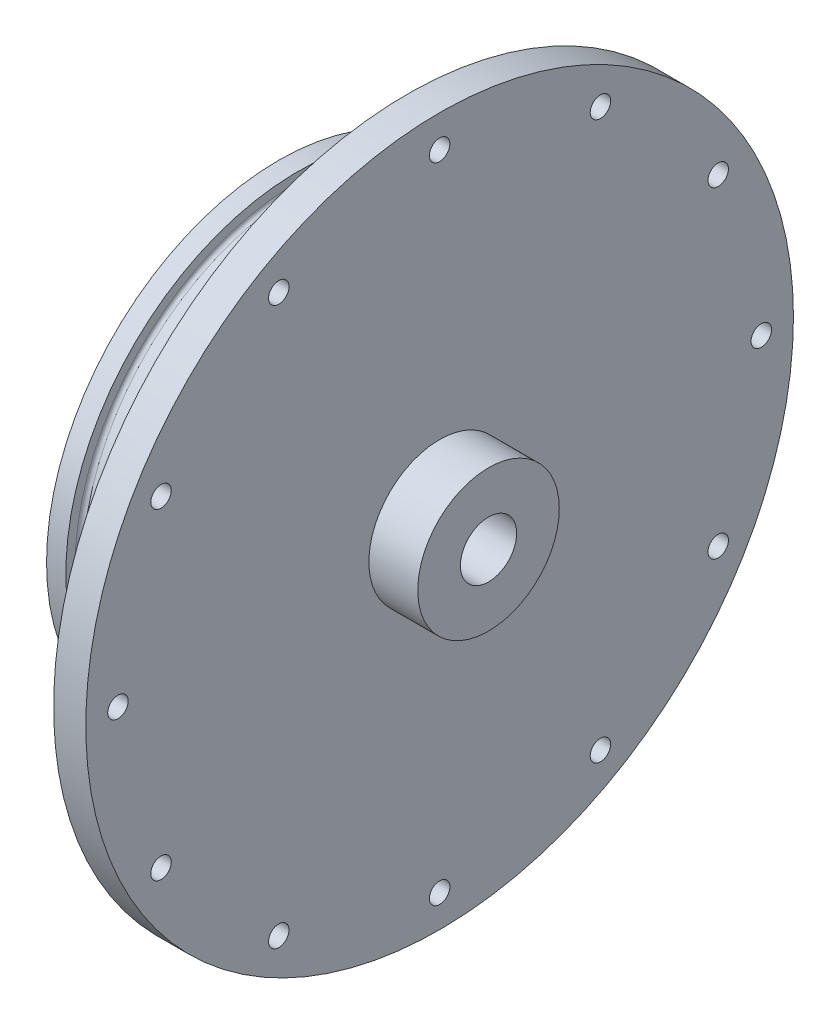
from build123d import *

# Parameters (mm, degrees)
SKETCH1_R               = 69.85
BOSS_EXTRUDE1_DEPTH     = 6.35
SKETCH2_R               = 45.847
BOSS_EXTRUDE2_DEPTH     = 25.4
SKETCH11_R              = 1.89865
CUT_EXTRUDE3_DEPTH      = 10.16
CIRPATTERN1_COUNT       = 12
CUT_EXTRUDE4_DEPTH      = 104.759854984
CUT_EXTRUDE4_DEPTH_BACK = 104.759854984
SKETCH15_R              = 5.55625
BOSS_EXTRUDE3_START     = 9.652
SKETCH17_R              = 13.97
SKETCH17_R_2            = 5.55625
BOSS_EXTRUDE3_DEPTH     = 9.652
SKETCH18_R              = 38.2905
CUT_EXTRUDE5_DEPTH      = 6.604
SKETCH19_R              = 1.1303
CUT_EXTRUDE6_DEPTH      = 6.35
SKETCH20_R              = 23.495
CUT_EXTRUDE7_DEPTH      = 19.05
FILLET1_R               = 2.54
CHAMFER1_SIZE           = 5.08
SKETCH21_R              = 2.0193
CUT_EXTRUDE8_DEPTH      = 104.759854954


with BuildPart() as part:
    # Sketch1 → Boss-Extrude1 (new body)
    with BuildSketch(Plane(origin=(0, 0, 0), x_dir=(0, 0, -1), z_dir=(1, 0, 0))):
        Circle(SKETCH1_R)
    extrude(amount=BOSS_EXTRUDE1_DEPTH)

    # Sketch2 → Boss-Extrude2 (add)
    with BuildSketch(Plane.ZY):
        Circle(SKETCH2_R)
    extrude(amount=BOSS_EXTRUDE2_DEPTH)

    # Sketch11 → Cut-Extrude3 (cut)
    with BuildSketch(Plane(origin=(0, 0, -45.847), x_dir=(-1, 0, 0), z_dir=(0, 0, -1))):
        with Locations((7.62, 0)):
            Circle(SKETCH11_R)
    cut_extrude3 = extrude(amount=-CUT_EXTRUDE3_DEPTH, mode=Mode.SUBTRACT)

    # CirPattern1: Cut-Extrude3 ×12 about axis
    cirpattern1_axis = Axis((0, 0, 0), (-1, 0, 0))
    for i in range(1, CIRPATTERN1_COUNT):
        add(cut_extrude3.rotate(cirpattern1_axis, i * 360 / CIRPATTERN1_COUNT), mode=Mode.SUBTRACT)

    # Sketch15 → Cut-Extrude4 (cut, two sides: drawn at the far end of the back side and taken through both)
    with BuildSketch(Plane(origin=(6.35, 0, 0), x_dir=(0, 0, -1), z_dir=(1, 0, 0)).offset(-CUT_EXTRUDE4_DEPTH_BACK)):
        Circle(SKETCH15_R)
    extrude(amount=CUT_EXTRUDE4_DEPTH + CUT_EXTRUDE4_DEPTH_BACK, mode=Mode.SUBTRACT)

    # Sketch16 → Cut-Revolve1 (revolve, cut)
    with BuildSketch(Plane.XY):
        with BuildLine():
            Line((-21.59, 45.847), (-14.4018, 45.847))
            Line((-14.4018, 45.847), (-14.4018, 44.069))
            ThreePointArc((-14.4018, 44.069), (-14.624984633, 43.530184633), (-15.1638, 43.307))
            Line((-15.1638, 43.307), (-20.828, 43.307))
            ThreePointArc((-20.828, 43.307), (-21.366815367, 43.530184633), (-21.59, 44.069))
            Line((-21.59, 44.069), (-21.59, 45.847))
        make_face()
    revolve(axis=Axis((0, 0, 0), (-1, 0, 0)), mode=Mode.SUBTRACT)

    # Sketch17 → Boss-Extrude3 (add)
    with BuildSketch(Plane(origin=(6.35, 0, 0), x_dir=(0, 0, -1), z_dir=(1, 0, 0)).offset(BOSS_EXTRUDE3_START)):
        Circle(SKETCH17_R)
        Circle(SKETCH17_R_2, mode=Mode.SUBTRACT)
    extrude(amount=-BOSS_EXTRUDE3_DEPTH)

    # Sketch18 → Cut-Extrude5 (cut)
    with BuildSketch(Plane.ZY.offset(25.4)):
        Circle(SKETCH18_R)
    extrude(amount=-CUT_EXTRUDE5_DEPTH, mode=Mode.SUBTRACT)

    # Sketch19 → Cut-Extrude6 (cut)
    with BuildSketch(Plane.ZY.offset(18.796)):
        with Locations((0, 33.3375)):
            Circle(SKETCH19_R)
        with Locations((23.573172318, 23.573172318)):
            Circle(SKETCH19_R)
        with Locations((33.3375, 0)):
            Circle(SKETCH19_R)
        with Locations((23.573172318, -23.573172318)):
            Circle(SKETCH19_R)
        with Locations((0, -33.3375)):
            Circle(SKETCH19_R)
        with Locations((-23.573172318, -23.573172318)):
            Circle(SKETCH19_R)
        with Locations((-33.3375, 0)):
            Circle(SKETCH19_R)
        with Locations((-23.573172318, 23.573172318)):
            Circle(SKETCH19_R)
    extrude(amount=-CUT_EXTRUDE6_DEPTH, mode=Mode.SUBTRACT)

    # Sketch20 → Cut-Extrude7 (cut)
    with BuildSketch(Plane.ZY.offset(18.796)):
        Circle(SKETCH20_R)
    extrude(amount=-CUT_EXTRUDE7_DEPTH, mode=Mode.SUBTRACT)

    # Fillet1
    fillet1_edges = [part.edges().sort_by_distance(p)[0] for p in [
        (0.254, 0, -23.495),
    ]]
    fillet(fillet1_edges, radius=FILLET1_R)

    # Chamfer1
    chamfer1_edges = [part.edges().sort_by_distance(p)[0] for p in [
        (0.254, 0, 5.55625),
    ]]
    chamfer(chamfer1_edges, length=CHAMFER1_SIZE)

    # Sketch21 → Cut-Extrude8 (cut, through all)
    with BuildSketch(Plane(origin=(6.35, 0, 0), x_dir=(0, 0, -1), z_dir=(1, 0, 0))):
        with Locations((0, 63.5)):
            Circle(SKETCH21_R)
        with Locations((31.75, 54.99261314)):
            Circle(SKETCH21_R)
        with Locations((54.99261314, 31.75)):
            Circle(SKETCH21_R)
        with Locations((63.5, 0)):
            Circle(SKETCH21_R)
        with Locations((54.99261314, -31.75)):
            Circle(SKETCH21_R)
        with Locations((31.75, -54.99261314)):
            Circle(SKETCH21_R)
        with Locations((0, -63.5)):
            Circle(SKETCH21_R)
        with Locations((-31.75, -54.99261314)):
            Circle(SKETCH21_R)
        with Locations((-54.99261314, -31.75)):
            Circle(SKETCH21_R)
        with Locations((-63.5, 0)):
            Circle(SKETCH21_R)
        with Locations((-54.99261314, 31.75)):
            Circle(SKETCH21_R)
        with Locations((-31.75, 54.99261314)):
            Circle(SKETCH21_R)
    extrude(amount=-CUT_EXTRUDE8_DEPTH, mode=Mode.SUBTRACT)


solid = part.part
